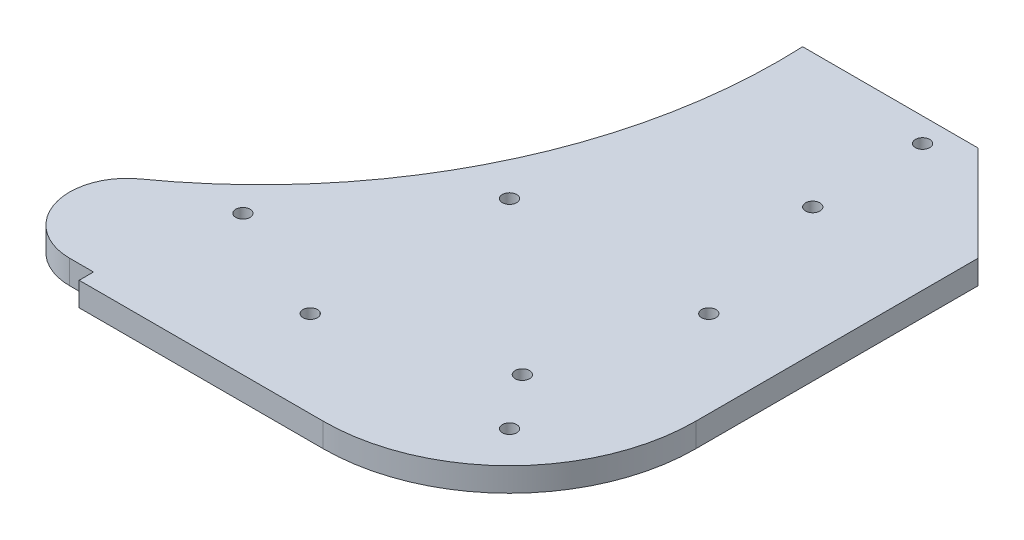
from build123d import *

# Parameters (mm, degrees)
BOSS_EXTRU_1_DEPTH      = 5
ESQUISSE2_R             = 1.5
ENL_V_MAT_EXTRU_1_DEPTH = 105.483064759
ESQUISSE3_R             = 1.5
ENL_V_MAT_EXTRU_2_DEPTH = 105.483064759


with BuildPart() as part:
    # Esquisse1 → Boss.-Extru.1 (new body)
    with BuildSketch(Plane(origin=(0, 0, 0), x_dir=(1, 0, 0), z_dir=(0, 1, 0))):
        with BuildLine():
            Line((-51.1, -39), (0, -39))
            ThreePointArc((0, -39), (27.577164466, -27.577164466), (39, 0))
            Line((39, 0), (39, 59.082873123))
            Line((39, 59.082873123), (19, 79.082873123))
            Line((19, 79.082873123), (-17.715268603, 79.082873123))
            ThreePointArc((-17.715268603, 79.082873123), (-28.51615758, 26.652464115), (-63.070954357, -14.232410975))
            ThreePointArc((-63.070954357, -14.232410975), (-67.528277829, -27.659845058), (-56.1, -36))
            Line((-56.1, -36), (-51.1, -36))
            Line((-51.1, -36), (-51.1, -39))
        make_face()
    extrude(amount=BOSS_EXTRU_1_DEPTH)

    # Esquisse2 → Enlèv. mat.-Extru.1 (cut, through all)
    with BuildSketch(Plane.XZ):
        with Locations((20.859650045, 20.859650045)):
            Circle(ESQUISSE2_R)
        with Locations((20.859650045, -20.859650045)):
            Circle(ESQUISSE2_R)
        with Locations((-20.859650045, -20.859650045)):
            Circle(ESQUISSE2_R)
        with Locations((-20.859650045, 20.859650045)):
            Circle(ESQUISSE2_R)
        with Locations((12.4, -74.082873123)):
            Circle(ESQUISSE2_R)
        with Locations((12.4, 9.717126877)):
            Circle(ESQUISSE2_R)
    extrude(amount=-ENL_V_MAT_EXTRU_1_DEPTH, mode=Mode.SUBTRACT)

    # Esquisse3 → Enlèv. mat.-Extru.2 (cut, through all)
    with BuildSketch(Plane(origin=(0, 5, 0), x_dir=(1, 0, 0), z_dir=(0, 1, 0))):
        with Locations((12.4, 51.082873123)):
            Circle(ESQUISSE3_R)
        with Locations((-46.1, -9.717126877)):
            Circle(ESQUISSE3_R)
    extrude(amount=-ENL_V_MAT_EXTRU_2_DEPTH, mode=Mode.SUBTRACT)


solid = part.part
